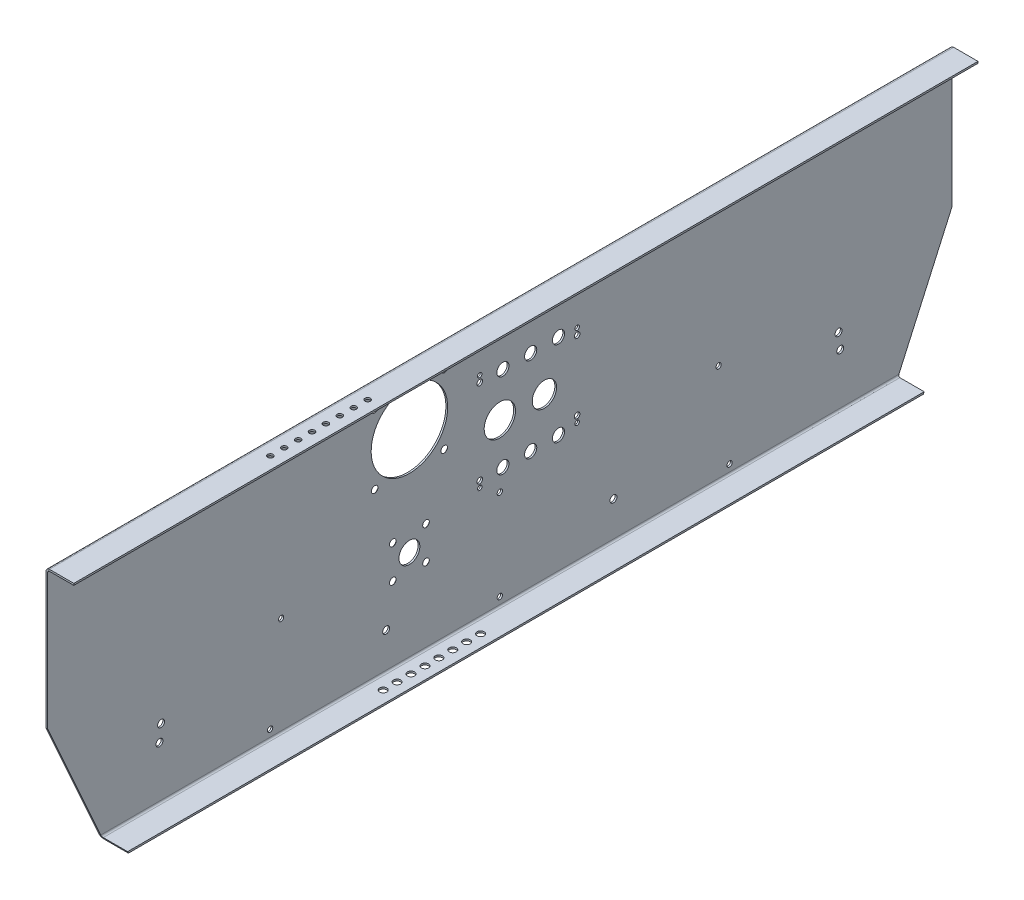
from build123d import *

# Parameters (mm, degrees)
BASE_FLANGE2_DEPTH                                 = 825.5
SKETCH1_R                                          = 3.175
SKETCH1_R_2                                        = 2.413
SKETCH1_R_3                                        = 5.55625
SKETCH1_R_4                                        = 2.5527
SKETCH1_R_5                                        = 2.0447
SKETCH1_R_6                                        = 14.28115
SKETCH1_R_7                                        = 11.10615
SKETCH1_R_8                                        = 1.5875
SKETCH1_R_9                                        = 9.525
SKETCH1_R_10                                       = 1.27
SKETCH1_R_11                                       = 34.925
CUT_EXTRUDE3_DEPTH                                 = 859.694710551
CSK_FOR_10_FLAT_HEAD_MACHINE_SCREW_100_D           = 4.9784
CSK_FOR_10_FLAT_HEAD_MACHINE_SCREW_100_CSINK_D     = 9.779
CSK_FOR_10_FLAT_HEAD_MACHINE_SCREW_100_CSINK_ANGLE = 100
SKETCH8_R                                          = 0.635
CUT_EXTRUDE4_DEPTH                                 = 860.130662682
F_1_4_CLEARANCE_HOLE1_D                            = 6.5278
F_1_4_CLEARANCE_HOLE1_DEPTH                        = 1.5875
F_8_CLEARANCE_HOLE1_D                              = 4.9149
F_8_CLEARANCE_HOLE1_DEPTH                          = 1.5875


# Sheet-metal steps are written as plain solids
with BuildPart() as part:
    # Sketch3 → Base-Flange2 (new body)
    with BuildSketch(Plane.XY):
        with BuildLine():
            Line((3.175, 233.4895), (25.4, 233.4895))
            Line((25.4, 233.4895), (25.4, 235.077))
            Line((25.4, 235.077), (3.175, 235.077))
            ThreePointArc((3.175, 235.077), (0.92993597, 234.14706403), (0, 231.902))
            Line((0, 231.902), (0, 0))
            ThreePointArc((0, 0), (0.92993597, -2.24506403), (3.175, -3.175))
            Line((3.175, -3.175), (25.4, -3.175))
            Line((25.4, -3.175), (25.4, -1.5875))
            Line((25.4, -1.5875), (3.175, -1.5875))
            ThreePointArc((3.175, -1.5875), (2.052467985, -1.122532015), (1.5875, 0))
            Line((1.5875, 0), (1.5875, 231.902))
            ThreePointArc((1.5875, 231.902), (2.052467985, 233.024532015), (3.175, 233.4895))
        make_face()
    extrude(amount=-BASE_FLANGE2_DEPTH)

    # Sketch1 → Cut-Extrude3 (cut, through all)
    with BuildSketch(Plane(origin=(0, 0, 0), x_dir=(0, 0, -1), z_dir=(1, 0, 0))):
        with Locations(Location((516.509, 31.75, 0), (0, 0, 90))):
            Circle(SKETCH1_R)
        with Locations(Location((308.991, 31.75, 0), (0, 0, 90))):
            Circle(SKETCH1_R)
        with Locations(Location((103.492550911, 60.630923565, 0), (0, 0, 90))):
            Circle(SKETCH1_R)
        with Locations(Location((722.007449089, 60.630923565, 0), (0, 0, 90))):
            Circle(SKETCH1_R)
        with Locations(Location((412.75, 6.35, 0), (0, 0, 90))):
            Circle(SKETCH1_R_2)
        with Locations(Location((412.75, 88.9, 0), (0, 0, 90))):
            Circle(SKETCH1_R_2)
        with Locations(Location((622.478249316, 6.35, 0), (0, 0, 90))):
            Circle(SKETCH1_R_2)
        with Locations(Location((612.465522577, 88.9, 0), (0, 0, 90))):
            Circle(SKETCH1_R_2)
        with Locations(Location((203.021750684, 6.35, 0), (0, 0, 90))):
            Circle(SKETCH1_R_2)
        with Locations(Location((101.978503418, 46.225723918, 0), (0, 0, 90))):
            Circle(SKETCH1_R)
        with Locations(Location((723.521496582, 46.225723918, 0), (0, 0, 90))):
            Circle(SKETCH1_R)
        with Locations(Location((213.034477423, 88.9, 0), (0, 0, 90))):
            Circle(SKETCH1_R_2)
        with Locations(Location((466.319936913, 184.736959746, 0), (0, 0, 90))):
            Circle(SKETCH1_R_3)
        with Locations(Location((483.337936913, 177.751959746, 0), (0, 0, 90))):
            Circle(SKETCH1_R_4)
        with Locations(Location((483.337936913, 183.593959746, 0), (0, 0, 90))):
            Circle(SKETCH1_R_5)
        with Locations(Location((483.337936913, 114.251959746, 0), (0, 0, 90))):
            Circle(SKETCH1_R_4)
        with Locations(Location((483.337936913, 108.409959746, 0), (0, 0, 90))):
            Circle(SKETCH1_R_5)
        with Locations(Location((466.319936913, 107.266959746, 0), (0, 0, 90))):
            Circle(SKETCH1_R_3)
        with Locations(Location((440.919936913, 107.266959746, 0), (0, 0, 90))):
            Circle(SKETCH1_R_3)
        with Locations(Location((415.519936913, 107.266959746, 0), (0, 0, 90))):
            Circle(SKETCH1_R_3)
        with Locations(Location((394.437936913, 107.266959746, 0), (0, 0, 90))):
            Circle(SKETCH1_R_4)
        with Locations(Location((394.437936913, 101.424959746, 0), (0, 0, 90))):
            Circle(SKETCH1_R_5)
        with Locations(Location((394.437936913, 184.736959746, 0), (0, 0, 90))):
            Circle(SKETCH1_R_4)
        with Locations(Location((394.437936913, 190.578959746, 0), (0, 0, 90))):
            Circle(SKETCH1_R_5)
        with Locations(Location((412.75, 146.001959746, 0), (0, 0, 90))):
            Circle(SKETCH1_R_6)
        with Locations(Location((453.4662, 146.001959746, 0), (0, 0, 90))):
            Circle(SKETCH1_R_7)
        with Locations(Location((440.919936913, 184.736959746, 0), (0, 0, 90))):
            Circle(SKETCH1_R_3)
        with Locations(Location((415.519936913, 184.736959746, 0), (0, 0, 90))):
            Circle(SKETCH1_R_3)
        with Locations(Location((345.35745, 97.70745, 0), (0, 0, 90))):
            Circle(SKETCH1_R_8)
        with Locations(Location((315.04255, 97.70745, 0), (0, 0, 90))):
            Circle(SKETCH1_R_8)
        with Locations(Location((315.04255, 67.39255, 0), (0, 0, 90))):
            Circle(SKETCH1_R_8)
        with Locations(Location((345.35745, 67.39255, 0), (0, 0, 90))):
            Circle(SKETCH1_R_8)
        with Locations(Location((330.2, 82.55, 0), (0, 0, 90))):
            Circle(SKETCH1_R_9)
        with Locations(Location((361.95, 211.6836, 0), (0, 0, 90))):
            Circle(SKETCH1_R_10)
        with Locations(Location((298.45, 211.6836, 0), (0, 0, 90))):
            Circle(SKETCH1_R_10)
        with Locations(Location((298.45, 148.1836, 0), (0, 0, 90))):
            Circle(SKETCH1_R_10)
        with Locations(Location((361.95, 148.1836, 0), (0, 0, 90))):
            Circle(SKETCH1_R_10)
        with Locations(Location((330.2, 179.9336, 0), (0, 0, 90))):
            Circle(SKETCH1_R_11)
        Polygon((825.5, -3.175), (775.673017562, -3.175), (825.5, 107.95), align=None)
        Polygon((0, 107.95), (0, -3.175), (49.826982438, -3.175), align=None)
    extrude(amount=CUT_EXTRUDE3_DEPTH, mode=Mode.SUBTRACT)

    # CSK for #10 Flat Head Machine Screw (100)1 (through all)
    with Locations(Plane.ZY):
        with Locations((-345.35745, 97.70745), (-315.04255, 97.70745), (-315.04255, 67.39255), (-345.35745, 67.39255), (-298.45, 148.1836), (-361.95, 148.1836), (-361.95, 211.6836), (-298.45, 211.6836)):
            CounterSinkHole(CSK_FOR_10_FLAT_HEAD_MACHINE_SCREW_100_D / 2, CSK_FOR_10_FLAT_HEAD_MACHINE_SCREW_100_CSINK_D / 2, counter_sink_angle=CSK_FOR_10_FLAT_HEAD_MACHINE_SCREW_100_CSINK_ANGLE)

    # Sketch8 → Cut-Extrude4 (cut, through all)
    with BuildSketch(Plane(origin=(0, -1.5875, 0), x_dir=(1, 0, 0), z_dir=(0, 1, 0))):
        with Locations(Location((14.2875, 382.481016783, 0), (0, 0, 180))):
            Circle(SKETCH8_R)
        with Locations(Location((14.2875, 369.781016783, 0), (0, 0, 180))):
            Circle(SKETCH8_R)
        with Locations(Location((14.2875, 357.081016783, 0), (0, 0, 180))):
            Circle(SKETCH8_R)
        with Locations(Location((14.2875, 344.381016783, 0), (0, 0, 180))):
            Circle(SKETCH8_R)
        with Locations(Location((14.2875, 331.681016783, 0), (0, 0, 180))):
            Circle(SKETCH8_R)
        with Locations(Location((14.2875, 318.981016783, 0), (0, 0, 180))):
            Circle(SKETCH8_R)
        with Locations(Location((14.2875, 306.281016783, 0), (0, 0, 180))):
            Circle(SKETCH8_R)
        with Locations(Location((14.2875, 293.581016783, 0), (0, 0, 180))):
            Circle(SKETCH8_R)
    extrude(amount=-CUT_EXTRUDE4_DEPTH, mode=Mode.SUBTRACT)

    # 1/4 Clearance Hole1
    with Locations(Plane(origin=(0, -1.5875, 0), x_dir=(1, 0, 0), z_dir=(0, 1, 0))):
        with Locations((14.2875, 382.481016783), (14.2875, 369.781016783), (14.2875, 357.081016783), (14.2875, 344.381016783), (14.2875, 331.681016783), (14.2875, 318.981016783), (14.2875, 306.281016783), (14.2875, 293.581016783)):
            Hole(F_1_4_CLEARANCE_HOLE1_D / 2, depth=F_1_4_CLEARANCE_HOLE1_DEPTH)

    # #8 Clearance Hole1
    with Locations(Plane(origin=(0, 233.4895, 0), x_dir=(-1, 0, 0), z_dir=(0, -1, 0))):
        with Locations((-14.2875, 279.4), (-14.2875, 266.7), (-14.2875, 254), (-14.2875, 241.3), (-14.2875, 228.6), (-14.2875, 215.9), (-14.2875, 203.2), (-14.2875, 190.5)):
            Hole(F_8_CLEARANCE_HOLE1_D / 2, depth=F_8_CLEARANCE_HOLE1_DEPTH)


solid = part.part
